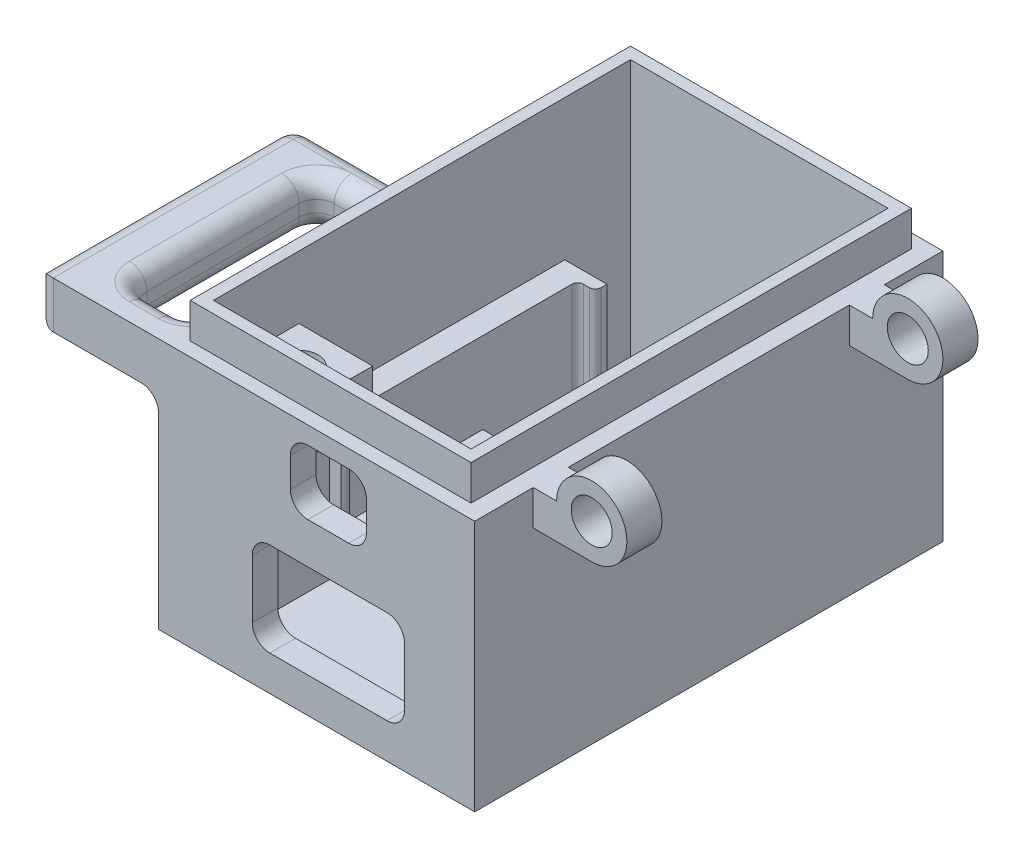
from build123d import *

# Parameters (mm, degrees)
SKETCH2_W                 = 27
SKETCH2_H                 = 40
BOSS_EXTRUDE1_DEPTH       = 1.5
SKETCH3_W                 = 27
SKETCH3_H                 = 40
SKETCH3_W_2               = 22
SKETCH3_H_2               = 35.62
BOSS_EXTRUDE2_DEPTH       = 20
SKETCH4_R                 = 1.75
BOSS_EXTRUDE3_DEPTH       = 40
BOSS_EXTRUDE4_DEPTH       = 11
SKETCH8_W                 = 17.78
SKETCH8_H                 = 20.7
BOSS_EXTRUDE5_DEPTH       = 3
FILLET1_R                 = 0.5
SKETCH9_W                 = 3.61
SKETCH9_H                 = 6.3
BOSS_EXTRUDE6_DEPTH       = 13.64
SKETCH10_W                = 6.3
SKETCH10_H                = 6.3
BOSS_EXTRUDE7_DEPTH       = 4
F_3_0MM_DOWEL_HOLE2_D     = 3.3
F_3_0MM_DOWEL_HOLE2_DEPTH = 2.8
F_3_0MM_DOWEL_HOLE2_TIP   = 0.991420021
CUT_EXTRUDE1_REACH        = 53.599
SKETCH13_W                = 13
SKETCH13_H                = 8
FILLET2_R                 = 1.5
CUT_EXTRUDE2_REACH        = 53.599
SKETCH14_W                = 6.5
SKETCH14_H                = 5.5
FILLET3_R                 = 1.5
SKETCH15_W                = 24
SKETCH15_H                = 37.62
SKETCH15_W_2              = 22
SKETCH15_H_2              = 35.62
BOSS_EXTRUDE8_DEPTH       = 3
BOSS_EXTRUDE9_DEPTH       = 4
FILLET4_R                 = 1.5
SKETCH17_W                = 5
SKETCH17_H                = 29.710811322
SKETCH17_H_2              = 26.502201667
SKETCH17_W_2              = 24
SKETCH17_H_3              = 26.060216056
CUT_EXTRUDE3_DEPTH        = 50.056090346


with BuildPart() as part:
    # Sketch2 → Boss-Extrude1 (new body)
    with BuildSketch(Plane(origin=(0, 0, 0), x_dir=(1, 0, 0), z_dir=(0, 1, 0))):
        Rectangle(SKETCH2_W, SKETCH2_H)
    extrude(amount=BOSS_EXTRUDE1_DEPTH)

    # Sketch3 → Boss-Extrude2 (add)
    with BuildSketch(Plane(origin=(0, 1.5, 0), x_dir=(1, 0, 0), z_dir=(0, 1, 0))):
        Rectangle(SKETCH3_W, SKETCH3_H)
        Rectangle(SKETCH3_W_2, SKETCH3_H_2, mode=Mode.SUBTRACT)
    extrude(amount=BOSS_EXTRUDE2_DEPTH)

    # Sketch4 → Boss-Extrude3 (add, through all)
    with BuildSketch(Plane.XY.offset(20)):
        with BuildLine():
            Line((15.5, 21.5), (13.5, 21.5))
            Line((13.5, 21.5), (13.5, 18.5))
            Line((13.5, 18.5), (18.5, 18.5))
            ThreePointArc((18.5, 18.5), (20.621320344, 23.621320344), (15.5, 21.5))
        make_face()
        with Locations((18.5, 21.5)):
            Circle(SKETCH4_R, mode=Mode.SUBTRACT)
    extrude(amount=-BOSS_EXTRUDE3_DEPTH)

    # Sketch6 → Boss-Extrude4 (add)
    with BuildSketch(Plane(origin=(0, 1.5, 0), x_dir=(1, 0, 0), z_dir=(0, 1, 0))):
        Polygon((8.89, -10.51), (7.39, -10.51), (7.39, -9.51), (8.89, -9.51), (8.89, 11.19), (7.39, 11.19), (7.39, 12.19), (8.89, 12.19), (11, 12.19), (11, -10.51), align=None)
        Polygon((-8.89, -10.51), (-11, -10.51), (-11, 12.19), (-8.89, 12.19), (-7.39, 12.19), (-7.39, 11.19), (-8.89, 11.19), (-8.89, -9.51), (-7.39, -9.51), (-7.39, -10.51), align=None)
    extrude(amount=BOSS_EXTRUDE4_DEPTH)

    # Sketch8 → Boss-Extrude5 (add)
    with BuildSketch(Plane(origin=(0, 1.5, 0), x_dir=(1, 0, 0), z_dir=(0, 1, 0))):
        with Locations((0, 0.84)):
            Rectangle(SKETCH8_W, SKETCH8_H)
    extrude(amount=BOSS_EXTRUDE5_DEPTH)

    # Fillet1
    fillet1_edges = [part.edges().sort_by_distance(p)[0] for p in [
        (7.39, 8.5, 9.51),
        (7.39, 8.5, -11.19),
        (8.89, 8.5, -11.19),
        (8.89, 8.5, 9.51),
        (-7.39, 8.5, 9.51),
        (-8.89, 8.5, 9.51),
        (-8.89, 8.5, -11.19),
        (-7.39, 8.5, -11.19),
    ]]
    fillet(fillet1_edges, radius=FILLET1_R)

    # Sketch9 → Boss-Extrude6 (add)
    with BuildSketch(Plane(origin=(0, 1.5, 0), x_dir=(1, 0, 0), z_dir=(0, 1, 0))):
        with Locations((-10.195, -13.66)):
            Rectangle(SKETCH9_W, SKETCH9_H)
        with Locations((9.195, -13.66)):
            Rectangle(SKETCH9_W, SKETCH9_H)
    extrude(amount=BOSS_EXTRUDE6_DEPTH)

    # Sketch10 → Boss-Extrude7 (add)
    with BuildSketch(Plane(origin=(0, 15.14, 0), x_dir=(1, 0, 0), z_dir=(0, 1, 0))):
        with Locations((-7.85, -13.66)):
            Rectangle(SKETCH10_W, SKETCH10_H)
        with Locations((7.85, -13.66)):
            Rectangle(SKETCH10_W, SKETCH10_H)
    extrude(amount=BOSS_EXTRUDE7_DEPTH)

    # Ø3.0mm Dowel Hole2
    with Locations(Plane(origin=(0, 19.14, 0), x_dir=(1, 0, 0), z_dir=(0, 1, 0))):
        with Locations((7.85, -13.66), (-7.85, -13.66)):
            Hole(F_3_0MM_DOWEL_HOLE2_D / 2, depth=F_3_0MM_DOWEL_HOLE2_DEPTH)
            with Locations((0, 0, -(F_3_0MM_DOWEL_HOLE2_DEPTH + F_3_0MM_DOWEL_HOLE2_TIP / 2))):  # 118° drill point
                Cone(0, F_3_0MM_DOWEL_HOLE2_D / 2, F_3_0MM_DOWEL_HOLE2_TIP, mode=Mode.SUBTRACT)

    # Sketch13 → Cut-Extrude1 (cut, up to next)
    with BuildSketch(Plane.XY.offset(20), mode=Mode.PRIVATE) as cut_extrude1_sk1:
        with Locations((1, 7)):
            Rectangle(SKETCH13_W, SKETCH13_H)
    cut_extrude1_tool1 = extrude(cut_extrude1_sk1.sketch, amount=-CUT_EXTRUDE1_REACH, mode=Mode.PRIVATE) & part.part
    add(cut_extrude1_tool1.solids().sort_by_distance((1, 7, 20))[0], mode=Mode.SUBTRACT)

    # Fillet2
    fillet2_edges = [part.edges().sort_by_distance(p)[0] for p in [
        (7.5, 3, 18.905),
        (7.5, 11, 18.905),
        (-5.5, 11, 18.905),
        (-5.5, 3, 18.905),
    ]]
    fillet(fillet2_edges, radius=FILLET2_R)

    # Sketch14 → Cut-Extrude2 (cut, up to next)
    with BuildSketch(Plane.XY.offset(20), mode=Mode.PRIVATE) as cut_extrude2_sk1:
        with Locations((1, 17.25)):
            Rectangle(SKETCH14_W, SKETCH14_H)
    cut_extrude2_tool1 = extrude(cut_extrude2_sk1.sketch, amount=-CUT_EXTRUDE2_REACH, mode=Mode.PRIVATE) & part.part
    add(cut_extrude2_tool1.solids().sort_by_distance((1, 17.25, 20))[0], mode=Mode.SUBTRACT)

    # Fillet3
    fillet3_edges = [part.edges().sort_by_distance(p)[0] for p in [
        (4.25, 14.5, 18.905),
        (4.25, 20, 18.905),
        (-2.25, 20, 18.905),
        (-2.25, 14.5, 18.905),
    ]]
    fillet(fillet3_edges, radius=FILLET3_R)

    # Sketch15 → Boss-Extrude8 (add)
    with BuildSketch(Plane(origin=(0, 21.5, 0), x_dir=(1, 0, 0), z_dir=(0, 1, 0))):
        Rectangle(SKETCH15_W, SKETCH15_H)
        Rectangle(SKETCH15_W_2, SKETCH15_H_2, mode=Mode.SUBTRACT)
    extrude(amount=BOSS_EXTRUDE8_DEPTH)

    # Sketch16 → Boss-Extrude9 (add)
    with BuildSketch(Plane(origin=(0, 21.5, 0), x_dir=(1, 0, 0), z_dir=(0, 1, 0))):
        Polygon((-13.5, -17), (-13.5, -20), (-24, -20), (-24, 2), (-13.5, 2), (-13.5, -1), (-19, -1), (-19, -17), align=None)
    extrude(amount=-BOSS_EXTRUDE9_DEPTH)

    # Fillet4
    fillet4_edges = [part.edges().sort_by_distance(p)[0] for p in [
        (-13.5, 17.5, 18.5),
        (-13.5, 21.5, 9),
        (-16.25, 17.5, 1),
        (-16.25, 17.5, 17),
        (-13.5, 19.5, 17),
        (-19, 17.5, 9),
        (-19, 19.5, 1),
        (-19, 19.5, 17),
        (-16.25, 21.5, 17),
        (-19, 21.5, 9),
        (-16.25, 21.5, 1),
        (-18.75, 17.5, -2),
        (-18.75, 21.5, -2),
        (-24, 19.5, 20),
        (-24, 21.5, 9),
        (-24, 17.5, 9),
        (-24, 19.5, -2),
    ]]
    fillet(fillet4_edges, radius=FILLET4_R - 0.0001)  # a hair under: the kernel refuses the full size

    # Sketch17 → Cut-Extrude3 (cut, through all)
    with BuildSketch(Plane(origin=(13.5, 0, 0), x_dir=(0, 0, -1), z_dir=(1, 0, 0))):
        with Locations((-17.5, 14.855405661)):
            Rectangle(SKETCH17_W, SKETCH17_H)
        with Locations((17.5, 13.251100834)):
            Rectangle(SKETCH17_W, SKETCH17_H_2)
        with Locations((0, 13.030108028)):
            Rectangle(SKETCH17_W_2, SKETCH17_H_3)
    extrude(amount=CUT_EXTRUDE3_DEPTH, mode=Mode.SUBTRACT)


solid = part.part
